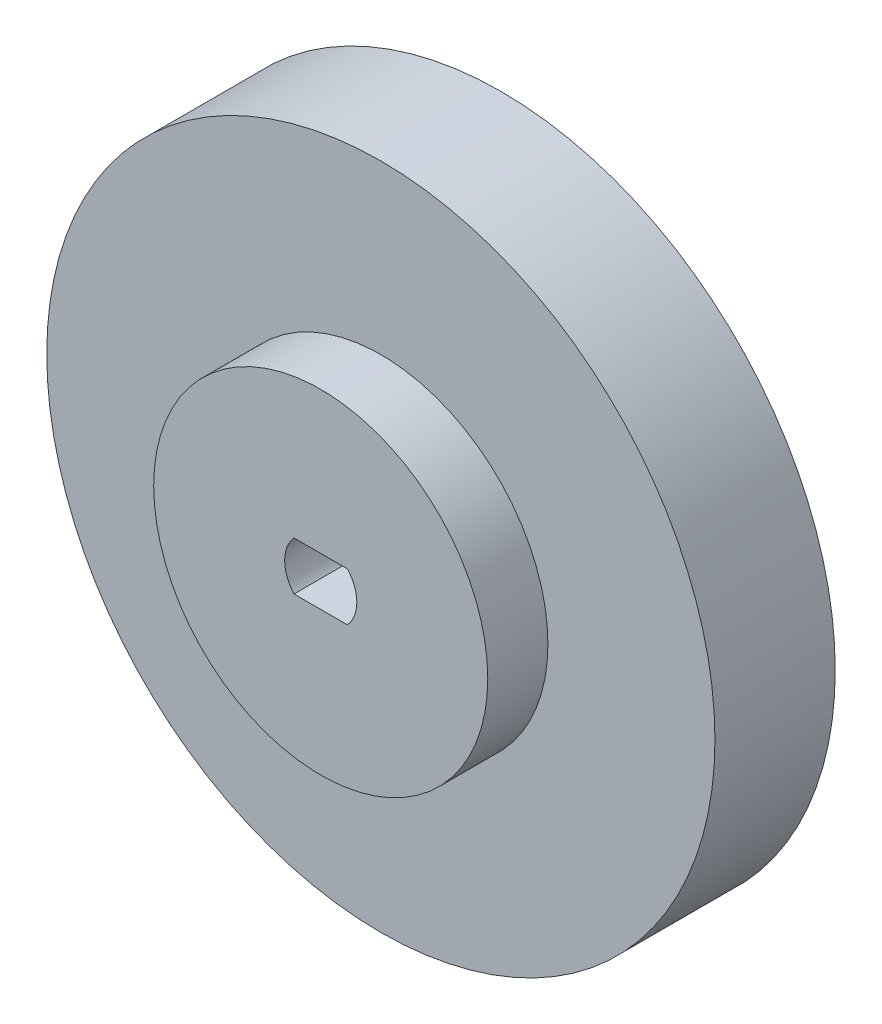
from build123d import *

# Parameters (mm, degrees)
SKETCH1_R           = 12.5
BOSS_EXTRUDE1_DEPTH = 18
BOSS_EXTRUDE2_START = -4.5
SKETCH2_R           = 25
BOSS_EXTRUDE2_DEPTH = 9
CUT_EXTRUDE1_DEPTH  = 40.67366885


with BuildPart() as part:
    # Sketch1 → Boss-Extrude1 (new body)
    with BuildSketch(Plane.XY):
        with Locations((0, -0.049046118)):
            Circle(SKETCH1_R)
    extrude(amount=BOSS_EXTRUDE1_DEPTH)

    # Sketch2 → Boss-Extrude2 (add)
    with BuildSketch(Plane.XY.offset(18).offset(BOSS_EXTRUDE2_START)):
        Circle(SKETCH2_R)
    extrude(amount=-BOSS_EXTRUDE2_DEPTH)

    # Sketch3 → Cut-Extrude1 (cut, through all)
    with BuildSketch(Plane.XY.offset(18)):
        with BuildLine():
            Line((-2, 1.813835715), (2, 1.813835715))
            ThreePointArc((2, 1.813835715), (2.7, 0), (2, -1.813835715))
            Line((2, -1.813835715), (-2, -1.813835715))
            ThreePointArc((-2, -1.813835715), (-2.7, 0), (-2, 1.813835715))
        make_face()
    extrude(amount=-CUT_EXTRUDE1_DEPTH, mode=Mode.SUBTRACT)


solid = part.part
